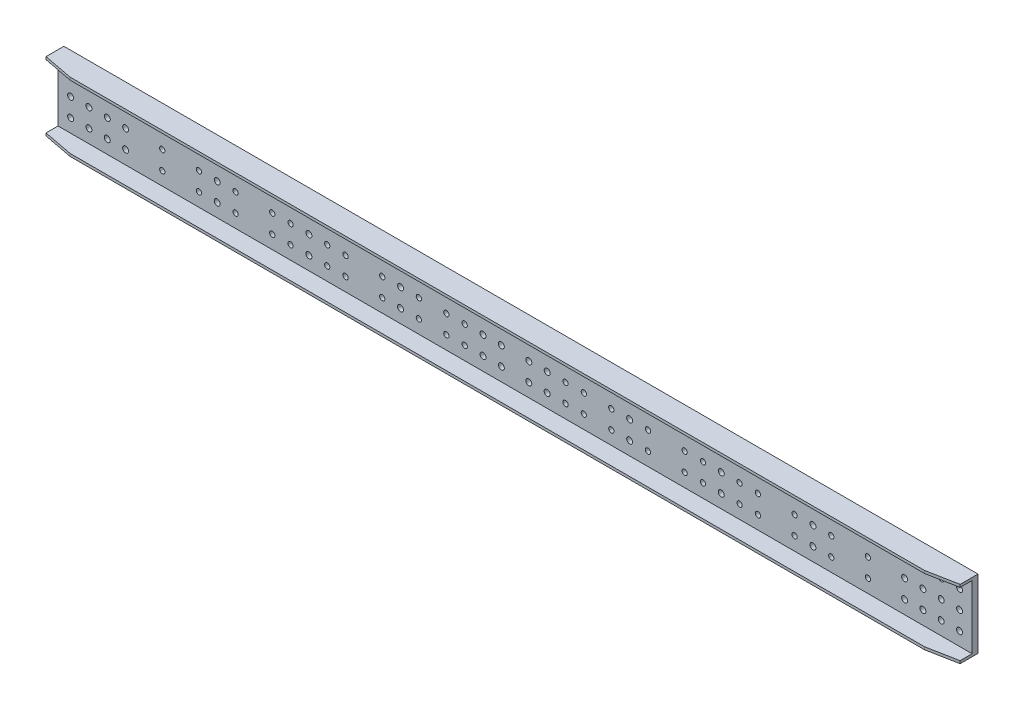
from build123d import *

# Parameters (mm, degrees)
SKETCH_1_W          = 3990
SKETCH_1_H          = 300
SKETCH_1_R          = 13
SKETCH_1_R_2        = 11.5
EXTRUDE_1539_DEPTH  = 25.5
SKETCH_2_W          = 3990
SKETCH_2_H          = 11.5
EXTRUDE_1_DEPTH     = 77.5
SKETCH_3_W          = 70
SKETCH_3_H          = 230
EXTRUDE_2_DEPTH     = 16
SKETCH_4_R          = 13
CUT_EXTRUDE_1_DEPTH = 2003.131676489
CUT_EXTRUDE_2_DEPTH = 2021.057919962


with BuildPart() as part:
    # 草图1 → Extrude 1539 (new body)
    with BuildSketch(Plane.XY):
        Rectangle(SKETCH_1_W, SKETCH_1_H)
        with Locations((1940, 80)):
            Circle(SKETCH_1_R, mode=Mode.SUBTRACT)
        with Locations((1860, 80)):
            Circle(SKETCH_1_R, mode=Mode.SUBTRACT)
        with Locations((1780, 80)):
            Circle(SKETCH_1_R, mode=Mode.SUBTRACT)
        with Locations((1700, 80)):
            Circle(SKETCH_1_R, mode=Mode.SUBTRACT)
        with Locations((1540, 80)):
            Circle(SKETCH_1_R_2, mode=Mode.SUBTRACT)
        with Locations((1380, 80)):
            Circle(SKETCH_1_R_2, mode=Mode.SUBTRACT)
        with Locations((1220, 80)):
            Circle(SKETCH_1_R_2, mode=Mode.SUBTRACT)
        with Locations((1060, 80)):
            Circle(SKETCH_1_R_2, mode=Mode.SUBTRACT)
        with Locations((980, 80)):
            Circle(SKETCH_1_R_2, mode=Mode.SUBTRACT)
        with Locations((820, 80)):
            Circle(SKETCH_1_R_2, mode=Mode.SUBTRACT)
        with Locations((740, 80)):
            Circle(SKETCH_1_R_2, mode=Mode.SUBTRACT)
        with Locations((580, 80)):
            Circle(SKETCH_1_R_2, mode=Mode.SUBTRACT)
        with Locations((980, 0)):
            Circle(SKETCH_1_R_2, mode=Mode.SUBTRACT)
        with Locations((1060, 0)):
            Circle(SKETCH_1_R_2, mode=Mode.SUBTRACT)
        with Locations((820, 0)):
            Circle(SKETCH_1_R_2, mode=Mode.SUBTRACT)
        with Locations((740, 0)):
            Circle(SKETCH_1_R_2, mode=Mode.SUBTRACT)
        with Locations((580, 0)):
            Circle(SKETCH_1_R_2, mode=Mode.SUBTRACT)
        with Locations((1220, 0)):
            Circle(SKETCH_1_R_2, mode=Mode.SUBTRACT)
        with Locations((1380, 0)):
            Circle(SKETCH_1_R_2, mode=Mode.SUBTRACT)
        with Locations((1540, 0)):
            Circle(SKETCH_1_R_2, mode=Mode.SUBTRACT)
        with Locations((1700, 0)):
            Circle(SKETCH_1_R, mode=Mode.SUBTRACT)
        with Locations((1780, 0)):
            Circle(SKETCH_1_R, mode=Mode.SUBTRACT)
        with Locations((1860, 0)):
            Circle(SKETCH_1_R, mode=Mode.SUBTRACT)
        with Locations((1940, 0)):
            Circle(SKETCH_1_R, mode=Mode.SUBTRACT)
        with Locations((420, 80)):
            Circle(SKETCH_1_R_2, mode=Mode.SUBTRACT)
        with Locations((420, 0)):
            Circle(SKETCH_1_R_2, mode=Mode.SUBTRACT)
        with Locations((300, 0)):
            Circle(SKETCH_1_R_2, mode=Mode.SUBTRACT)
        with Locations((300, 80)):
            Circle(SKETCH_1_R_2, mode=Mode.SUBTRACT)
        with Locations((220, 80)):
            Circle(SKETCH_1_R_2, mode=Mode.SUBTRACT)
        with Locations((220, 0)):
            Circle(SKETCH_1_R_2, mode=Mode.SUBTRACT)
        with Locations((140, 0)):
            Circle(SKETCH_1_R, mode=Mode.SUBTRACT)
        with Locations((140, 80)):
            Circle(SKETCH_1_R, mode=Mode.SUBTRACT)
        with Locations((60, 80)):
            Circle(SKETCH_1_R, mode=Mode.SUBTRACT)
        with Locations((60, 0)):
            Circle(SKETCH_1_R, mode=Mode.SUBTRACT)
        with Locations((1700, -80)):
            Circle(SKETCH_1_R, mode=Mode.SUBTRACT)
        with Locations((1780, -80)):
            Circle(SKETCH_1_R, mode=Mode.SUBTRACT)
        with Locations((1860, -80)):
            Circle(SKETCH_1_R, mode=Mode.SUBTRACT)
        with Locations((1940, -80)):
            Circle(SKETCH_1_R, mode=Mode.SUBTRACT)
        with Locations((580, -80)):
            Circle(SKETCH_1_R_2, mode=Mode.SUBTRACT)
        with Locations((740, -80)):
            Circle(SKETCH_1_R_2, mode=Mode.SUBTRACT)
        with Locations((820, -80)):
            Circle(SKETCH_1_R_2, mode=Mode.SUBTRACT)
        with Locations((980, -80)):
            Circle(SKETCH_1_R_2, mode=Mode.SUBTRACT)
        with Locations((1060, -80)):
            Circle(SKETCH_1_R_2, mode=Mode.SUBTRACT)
        with Locations((1220, -80)):
            Circle(SKETCH_1_R_2, mode=Mode.SUBTRACT)
        with Locations((1380, -80)):
            Circle(SKETCH_1_R_2, mode=Mode.SUBTRACT)
        with Locations((1540, -80)):
            Circle(SKETCH_1_R_2, mode=Mode.SUBTRACT)
        with Locations((220, -80)):
            Circle(SKETCH_1_R_2, mode=Mode.SUBTRACT)
        with Locations((300, -80)):
            Circle(SKETCH_1_R_2, mode=Mode.SUBTRACT)
        with Locations((420, -80)):
            Circle(SKETCH_1_R_2, mode=Mode.SUBTRACT)
        with Locations((60, -80)):
            Circle(SKETCH_1_R, mode=Mode.SUBTRACT)
        with Locations((140, -80)):
            Circle(SKETCH_1_R, mode=Mode.SUBTRACT)
        with Locations((-140, -80)):
            Circle(SKETCH_1_R, mode=Mode.SUBTRACT)
        with Locations((-60, -80)):
            Circle(SKETCH_1_R, mode=Mode.SUBTRACT)
        with Locations((-580, -80)):
            Circle(SKETCH_1_R_2, mode=Mode.SUBTRACT)
        with Locations((-420, -80)):
            Circle(SKETCH_1_R_2, mode=Mode.SUBTRACT)
        with Locations((-300, -80)):
            Circle(SKETCH_1_R_2, mode=Mode.SUBTRACT)
        with Locations((-220, -80)):
            Circle(SKETCH_1_R_2, mode=Mode.SUBTRACT)
        with Locations((-1540, -80)):
            Circle(SKETCH_1_R_2, mode=Mode.SUBTRACT)
        with Locations((-1380, -80)):
            Circle(SKETCH_1_R_2, mode=Mode.SUBTRACT)
        with Locations((-1220, -80)):
            Circle(SKETCH_1_R_2, mode=Mode.SUBTRACT)
        with Locations((-1060, -80)):
            Circle(SKETCH_1_R_2, mode=Mode.SUBTRACT)
        with Locations((-980, -80)):
            Circle(SKETCH_1_R_2, mode=Mode.SUBTRACT)
        with Locations((-820, -80)):
            Circle(SKETCH_1_R_2, mode=Mode.SUBTRACT)
        with Locations((-740, -80)):
            Circle(SKETCH_1_R_2, mode=Mode.SUBTRACT)
        with Locations((-1940, -80)):
            Circle(SKETCH_1_R, mode=Mode.SUBTRACT)
        with Locations((-1860, -80)):
            Circle(SKETCH_1_R, mode=Mode.SUBTRACT)
        with Locations((-1780, -80)):
            Circle(SKETCH_1_R, mode=Mode.SUBTRACT)
        with Locations((-1700, -80)):
            Circle(SKETCH_1_R, mode=Mode.SUBTRACT)
        with Locations((-60, 0)):
            Circle(SKETCH_1_R, mode=Mode.SUBTRACT)
        with Locations((-60, 80)):
            Circle(SKETCH_1_R, mode=Mode.SUBTRACT)
        with Locations((-140, 80)):
            Circle(SKETCH_1_R, mode=Mode.SUBTRACT)
        with Locations((-140, 0)):
            Circle(SKETCH_1_R, mode=Mode.SUBTRACT)
        with Locations((-220, 0)):
            Circle(SKETCH_1_R_2, mode=Mode.SUBTRACT)
        with Locations((-220, 80)):
            Circle(SKETCH_1_R_2, mode=Mode.SUBTRACT)
        with Locations((-300, 80)):
            Circle(SKETCH_1_R_2, mode=Mode.SUBTRACT)
        with Locations((-300, 0)):
            Circle(SKETCH_1_R_2, mode=Mode.SUBTRACT)
        with Locations((-420, 0)):
            Circle(SKETCH_1_R_2, mode=Mode.SUBTRACT)
        with Locations((-420, 80)):
            Circle(SKETCH_1_R_2, mode=Mode.SUBTRACT)
        with Locations((-1940, 0)):
            Circle(SKETCH_1_R, mode=Mode.SUBTRACT)
        with Locations((-1860, 0)):
            Circle(SKETCH_1_R, mode=Mode.SUBTRACT)
        with Locations((-1780, 0)):
            Circle(SKETCH_1_R, mode=Mode.SUBTRACT)
        with Locations((-1700, 0)):
            Circle(SKETCH_1_R, mode=Mode.SUBTRACT)
        with Locations((-1540, 0)):
            Circle(SKETCH_1_R_2, mode=Mode.SUBTRACT)
        with Locations((-1380, 0)):
            Circle(SKETCH_1_R_2, mode=Mode.SUBTRACT)
        with Locations((-1220, 0)):
            Circle(SKETCH_1_R_2, mode=Mode.SUBTRACT)
        with Locations((-580, 0)):
            Circle(SKETCH_1_R_2, mode=Mode.SUBTRACT)
        with Locations((-740, 0)):
            Circle(SKETCH_1_R_2, mode=Mode.SUBTRACT)
        with Locations((-820, 0)):
            Circle(SKETCH_1_R_2, mode=Mode.SUBTRACT)
        with Locations((-1060, 0)):
            Circle(SKETCH_1_R_2, mode=Mode.SUBTRACT)
        with Locations((-980, 0)):
            Circle(SKETCH_1_R_2, mode=Mode.SUBTRACT)
        with Locations((-580, 80)):
            Circle(SKETCH_1_R_2, mode=Mode.SUBTRACT)
        with Locations((-740, 80)):
            Circle(SKETCH_1_R_2, mode=Mode.SUBTRACT)
        with Locations((-820, 80)):
            Circle(SKETCH_1_R_2, mode=Mode.SUBTRACT)
        with Locations((-980, 80)):
            Circle(SKETCH_1_R_2, mode=Mode.SUBTRACT)
        with Locations((-1060, 80)):
            Circle(SKETCH_1_R_2, mode=Mode.SUBTRACT)
        with Locations((-1220, 80)):
            Circle(SKETCH_1_R_2, mode=Mode.SUBTRACT)
        with Locations((-1380, 80)):
            Circle(SKETCH_1_R_2, mode=Mode.SUBTRACT)
        with Locations((-1540, 80)):
            Circle(SKETCH_1_R_2, mode=Mode.SUBTRACT)
        with Locations((-1700, 80)):
            Circle(SKETCH_1_R, mode=Mode.SUBTRACT)
        with Locations((-1780, 80)):
            Circle(SKETCH_1_R, mode=Mode.SUBTRACT)
        with Locations((-1860, 80)):
            Circle(SKETCH_1_R, mode=Mode.SUBTRACT)
        with Locations((-1940, 80)):
            Circle(SKETCH_1_R, mode=Mode.SUBTRACT)
    extrude(amount=EXTRUDE_1539_DEPTH)

    # 草图2 → 凸台-拉伸1 (add)
    with BuildSketch(Plane.XY.offset(25.5)):
        with Locations((0, 144.25)):
            Rectangle(SKETCH_2_W, SKETCH_2_H)
        with Locations((0, -144.25)):
            Rectangle(SKETCH_2_W, SKETCH_2_H)
    extrude(amount=EXTRUDE_1_DEPTH)

    # 草图3 → 凸台-拉伸2 (add)
    with BuildSketch(Plane(origin=(0, 0, 0), x_dir=(-1, 0, 0), z_dir=(0, 0, -1))):
        with Locations((1300, 0)):
            Rectangle(SKETCH_3_W, SKETCH_3_H)
        with Locations((900, 0)):
            Rectangle(SKETCH_3_W, SKETCH_3_H)
        with Locations((-1300, 0)):
            Rectangle(SKETCH_3_W, SKETCH_3_H)
        with Locations((500, 0)):
            Rectangle(SKETCH_3_W, SKETCH_3_H)
        with Locations((-900, 0)):
            Rectangle(SKETCH_3_W, SKETCH_3_H)
        with Locations((-500, 0)):
            Rectangle(SKETCH_3_W, SKETCH_3_H)
    extrude(amount=EXTRUDE_2_DEPTH)

    # 草图4 → 切除-拉伸1 (cut, through all)
    with BuildSketch(Plane.XY.offset(25.5)):
        with Locations((1300, 80)):
            Circle(SKETCH_4_R)
        with Locations((900, 80)):
            Circle(SKETCH_4_R)
        with Locations((900, 0)):
            Circle(SKETCH_4_R)
        with Locations((1300, 0)):
            Circle(SKETCH_4_R)
        with Locations((900, -80)):
            Circle(SKETCH_4_R)
        with Locations((1300, -80)):
            Circle(SKETCH_4_R)
        with Locations((500, 80)):
            Circle(SKETCH_4_R)
        with Locations((500, 0)):
            Circle(SKETCH_4_R)
        with Locations((500, -80)):
            Circle(SKETCH_4_R)
        with Locations((-500, -80)):
            Circle(SKETCH_4_R)
        with Locations((-500, 0)):
            Circle(SKETCH_4_R)
        with Locations((-500, 80)):
            Circle(SKETCH_4_R)
        with Locations((-1300, -80)):
            Circle(SKETCH_4_R)
        with Locations((-900, -80)):
            Circle(SKETCH_4_R)
        with Locations((-1300, 0)):
            Circle(SKETCH_4_R)
        with Locations((-900, 0)):
            Circle(SKETCH_4_R)
        with Locations((-900, 80)):
            Circle(SKETCH_4_R)
        with Locations((-1300, 80)):
            Circle(SKETCH_4_R)
    extrude(amount=-CUT_EXTRUDE_1_DEPTH, mode=Mode.SUBTRACT)

    # 草图5 → 切除-拉伸2 (cut, through all)
    with BuildSketch(Plane(origin=(0, 150, 0), x_dir=(-1, 0, 0), z_dir=(0, 1, 0))):
        Polygon((-1995, 78), (-1995, 103), (-1865, 103), align=None)
        Polygon((1865, 103), (1995, 78), (1995, 103), align=None)
    extrude(amount=-CUT_EXTRUDE_2_DEPTH, mode=Mode.SUBTRACT)


solid = part.part
